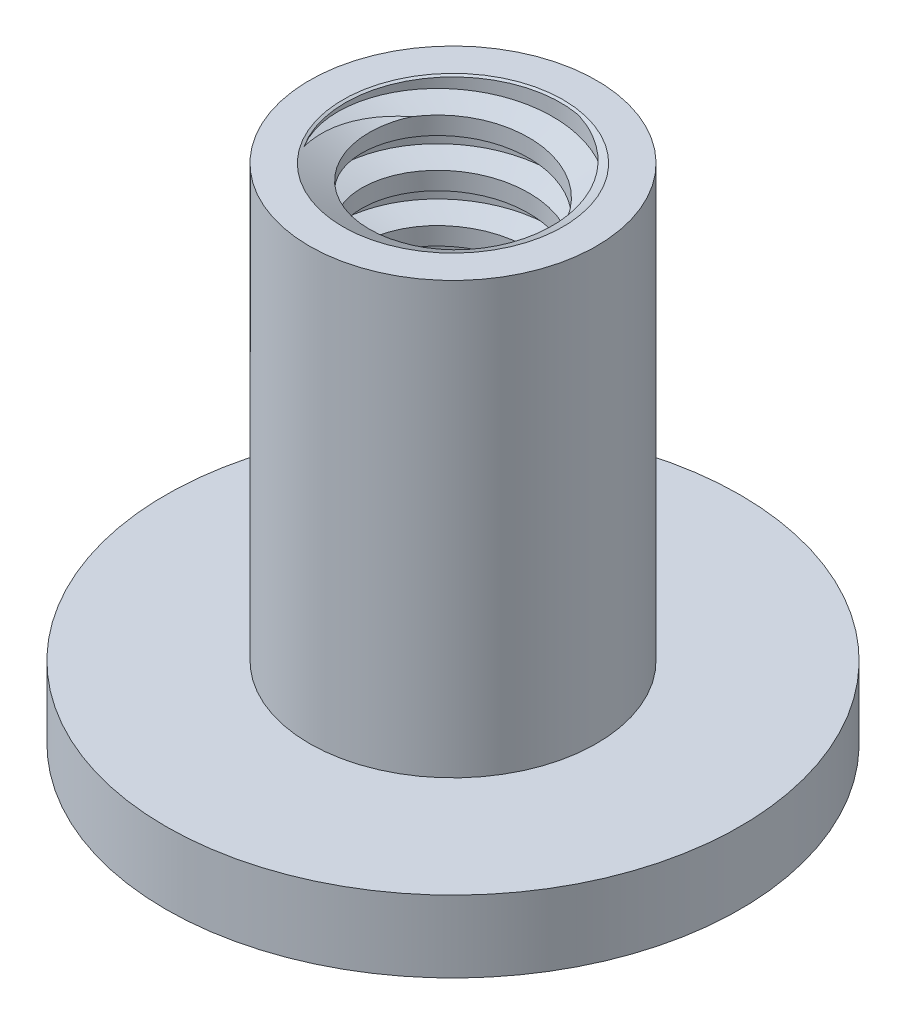
from build123d import *

# Parameters (mm, degrees)
SKETCH1_R                    = 12.7
BOSS_EXTRUDE1_DEPTH          = 22.225
CUT_EXTRUDE1_REACH           = 30.575
SKETCH2_R                    = 4.7625
SWEEP1_PITCH                 = 2.116666667
SKETCH5_R                    = 4.868333333
CUT_EXTRUDE3_OTHER_WAY_DEPTH = 31.250628475
CUT_EXTRUDE3_OTHER_WAY_TAPER = -60
SKETCH6_R                    = 4.868333333
CUT_EXTRUDE4_OTHER_WAY_DEPTH = 29.575000167
CUT_EXTRUDE4_OTHER_WAY_TAPER = -60
SKETCH7_OUTSIDE_W            = 35.848
SKETCH7_OUTSIDE_H            = 35.848
SKETCH7_OUTSIDE_R            = 6.35
CUT_EXTRUDE5_DEPTH           = 19.05


with BuildPart() as part:
    # Sketch1 → Boss-Extrude1 (new body)
    with BuildSketch(Plane(origin=(0, 0, 0), x_dir=(1, 0, 0), z_dir=(0, 1, 0))):
        with Locations(Location((0, 0, 0), (0, 0, 270))):
            Circle(SKETCH1_R)
    extrude(amount=BOSS_EXTRUDE1_DEPTH)

    # Sketch2 → Cut-Extrude1 (cut, up to next)
    with BuildSketch(Plane(origin=(0, 22.225, 0), x_dir=(1, 0, 0), z_dir=(0, 1, 0)), mode=Mode.PRIVATE) as cut_extrude1_sk1:
        with Locations(Location((0, 0, 0), (0, 0, 270))):
            Circle(SKETCH2_R)
    cut_extrude1_tool1 = extrude(cut_extrude1_sk1.sketch, amount=-CUT_EXTRUDE1_REACH, mode=Mode.PRIVATE) & part.part
    add(cut_extrude1_tool1.solids().sort_by_distance((0, 22.225, 0))[0], mode=Mode.SUBTRACT)

    # Sweep1: the profile of Sketch4 profile screwed along a right-hand helix of 11.5 turns, 10 arcs to a turn; built about Z, then put on its axis
    sweep1_z = Axis((0, 0, 0), (0, 0, 1))
    sweep1_corners = [(4.7628, 0, -1.332114529), (3.704166667, 0, -1.058333333), (3.704166667, 0, -0.27370361), (4.7628, 0, 7.7585e-05)]
    with BuildLine(mode=Mode.PRIVATE) as sweep1_profile:
        Line(sweep1_corners[0], sweep1_corners[1])
        Line(sweep1_corners[1], sweep1_corners[2])
        Line(sweep1_corners[2], sweep1_corners[3])
        Line(sweep1_corners[3], sweep1_corners[0])
    sweep1_cap = Face(sweep1_profile.wire())
    sweep1_turn_angles = [0, 18, 36, 54, 72, 90, 108, 126, 144, 162, 180, 198, 216, 234, 252, 270, 288, 306, 324, 342, 360]
    sweep1_turn_weights = [1, 0.9510565162951535, 1, 0.9510565162951535, 1, 0.9510565162951535, 1, 0.9510565162951535, 1, 0.9510565162951535, 1, 0.9510565162951535, 1, 0.9510565162951535, 1, 0.9510565162951535, 1, 0.9510565162951535, 1, 0.9510565162951535, 1]
    sweep1_turn_rails = [Edge.make_bspline([Vector(p[0], p[1], 0).rotate(sweep1_z, sweep1_turn_angles[k]) / sweep1_turn_weights[k] + Vector(0, 0, p[2] + SWEEP1_PITCH * sweep1_turn_angles[k] / 360) for k in range(21)], [0, 0, 0, 1, 1, 2, 2, 3, 3, 4, 4, 5, 5, 6, 6, 7, 7, 8, 8, 9, 9, 10, 10, 10], 2, sweep1_turn_weights) for p in sweep1_corners]
    sweep1_turn_sides = [Face.make_surface_from_curves(sweep1_turn_rails[p[0]], sweep1_turn_rails[p[1]]) for p in [(0, 1), (1, 2), (2, 3), (3, 0)]]
    sweep1_last_angles = [3960, 3978, 3996, 4014, 4032, 4050, 4068, 4086, 4104, 4122, 4140]
    sweep1_last_weights = [1, 0.9510565162951535, 1, 0.9510565162951535, 1, 0.9510565162951535, 1, 0.9510565162951535, 1, 0.9510565162951389, 1]
    sweep1_last_rails = [Edge.make_bspline([Vector(p[0], p[1], 0).rotate(sweep1_z, sweep1_last_angles[k]) / sweep1_last_weights[k] + Vector(0, 0, p[2] + SWEEP1_PITCH * sweep1_last_angles[k] / 360) for k in range(11)], [0, 0, 0, 1, 1, 2, 2, 3, 3, 4, 4, 5, 5, 5], 2, sweep1_last_weights) for p in sweep1_corners]
    sweep1_last_sides = [Face.make_surface_from_curves(sweep1_last_rails[p[0]], sweep1_last_rails[p[1]]) for p in [(0, 1), (1, 2), (2, 3), (3, 0)]]
    sweep1 = Plane(origin=(0, 22.225, 0), x_dir=(0, 0, -1), z_dir=(0, -1, 0)) * Solid(Shell([*[p.moved(Location((0, 0, SWEEP1_PITCH * i))) for i in range(11) for p in sweep1_turn_sides], *sweep1_last_sides, sweep1_cap, sweep1_cap.rotate(sweep1_z, 4140).moved(Location((0, 0, SWEEP1_PITCH * 4140 / 360)))]))
    add(sweep1)

    # Cut-Extrude3 cone 1 section (through the dimple's axis) → Cut-Extrude3 (revolve, cut)
    with BuildSketch(Plane(origin=(0, 22.225, 0), x_dir=(0, 0, 1), z_dir=(1, 0, 0))):
        Polygon((0, 0), (4.868333333, 0), (0, 2.810733561), align=None)
    revolve(axis=Axis((0, 22.225, 0), (0, -1, 0)), mode=Mode.SUBTRACT)

    # Sketch5 → Cut-Extrude3 other way (cut)
    with BuildSketch(Plane(origin=(0, 22.225, 0), x_dir=(1, 0, 0), z_dir=(0, 1, 0))):
        Circle(SKETCH5_R)
    extrude(amount=CUT_EXTRUDE3_OTHER_WAY_DEPTH, taper=CUT_EXTRUDE3_OTHER_WAY_TAPER, mode=Mode.SUBTRACT)

    # Cut-Extrude4 cone 1 section (through the dimple's axis) → Cut-Extrude4 (revolve, cut)
    with BuildSketch(Plane(origin=(0, 0, 0), x_dir=(0, 0, -1), z_dir=(1, 0, 0))):
        Polygon((0, 0), (4.868333333, 0), (0, 2.810733561), align=None)
    revolve(axis=Axis((0, 0, 0), (0, 1, 0)), mode=Mode.SUBTRACT)

    # Sketch6 → Cut-Extrude4 other way (cut)
    with BuildSketch(Plane.XZ):
        Circle(SKETCH6_R)
    extrude(amount=CUT_EXTRUDE4_OTHER_WAY_DEPTH, taper=CUT_EXTRUDE4_OTHER_WAY_TAPER, mode=Mode.SUBTRACT)

    # Sketch7 outside → Cut-Extrude5 (cut)
    with BuildSketch(Plane(origin=(0, 22.225, 0), x_dir=(1, 0, 0), z_dir=(0, 1, 0))):
        Rectangle(SKETCH7_OUTSIDE_W, SKETCH7_OUTSIDE_H)
        with Locations(Location((0, 0, 0), (0, 0, 270))):
            Circle(SKETCH7_OUTSIDE_R, mode=Mode.SUBTRACT)
    extrude(amount=-CUT_EXTRUDE5_DEPTH, mode=Mode.SUBTRACT)


solid = part.part
